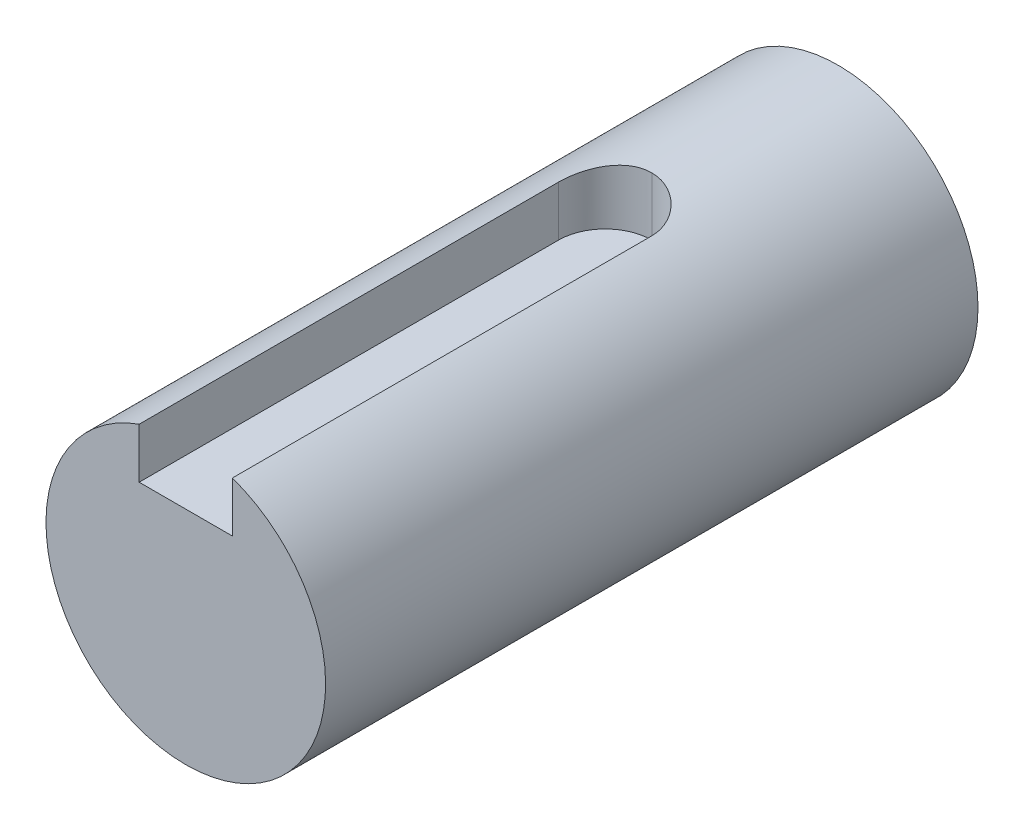
from build123d import *

# Parameters (mm, degrees)
SKETCH1_R           = 6
BOSS_EXTRUDE1_DEPTH = 28
SKETCH2_W           = 4
SKETCH2_H           = 2.5
CUT_EXTRUDE1_DEPTH  = 20
FILLET2_R           = 2
FILLET3_R           = 2


with BuildPart() as part:
    # Sketch1 → Boss-Extrude1 (new body)
    with BuildSketch(Plane.XY):
        Circle(SKETCH1_R)
    extrude(amount=BOSS_EXTRUDE1_DEPTH)

    # Sketch2 → Cut-Extrude1 (cut)
    with BuildSketch(Plane.XY.offset(28)):
        with Locations((0, 4.75)):
            Rectangle(SKETCH2_W, SKETCH2_H)
    extrude(amount=-CUT_EXTRUDE1_DEPTH, mode=Mode.SUBTRACT)

    # Fillet2
    fillet2_edges = [part.edges().sort_by_distance(p)[0] for p in [
        (-2, 4.578427125, 8),
    ]]
    fillet(fillet2_edges, radius=FILLET2_R)

    # Fillet3
    fillet3_edges = [part.edges().sort_by_distance(p)[0] for p in [
        (2, 4.578427125, 8),
    ]]
    fillet(fillet3_edges, radius=FILLET3_R - 0.0001)  # a hair under: the kernel refuses the full size


solid = part.part
